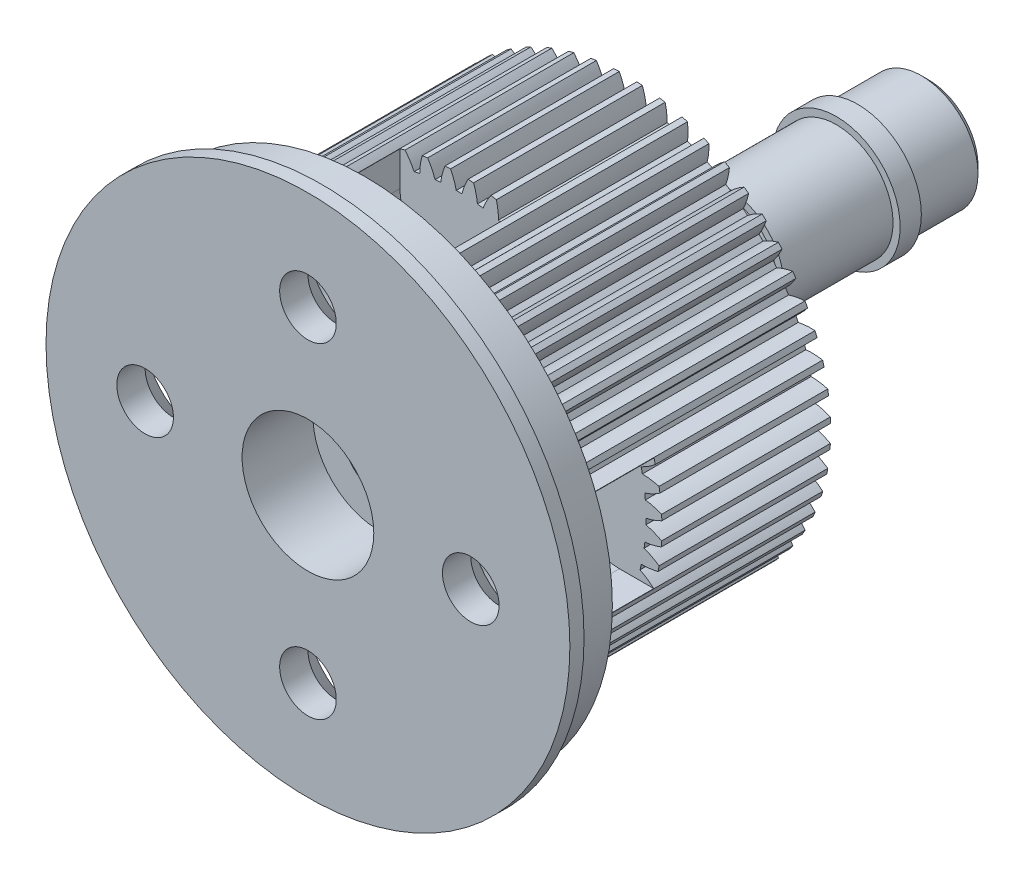
from build123d import *

# Parameters (mm, degrees)
SKETCH1_R           = 14.5
BOSS_EXTRUDE1_DEPTH = 16.661690565
CUT_EXTRUDE1_DEPTH  = 27.421807896
CIRPATTERN2_COUNT   = 56
SKETCH3_W           = 17.5
SKETCH3_H           = 4
CHAMFER2_SIZE       = 0.5
SKETCH4_R           = 2.5
CUT_EXTRUDE2_DEPTH  = 51.328806271
SKETCH5_R           = 4.65
CUT_EXTRUDE3_DEPTH  = 5
SKETCH6_R           = 2
CUT_EXTRUDE4_DEPTH  = 47.887116478
CIRPATTERN3_COUNT   = 4
CUT_EXTRUDE9_DEPTH  = 6.5
SKETCH9_R           = 18.5
SKETCH9_R_2         = 17.5
BOSS_EXTRUDE2_DEPTH = 1
CIRPATTERN4_COUNT   = 4
CUT_EXTRUDE12_START = -14.90536252
SKETCH10_R          = 20.678768913
SKETCH10_R_2        = 4
CUT_EXTRUDE12_DEPTH = 14.90536252
SKETCH11_R          = 4.5
SKETCH11_R_2        = 4
BOSS_EXTRUDE3_DEPTH = 1.5
CUT_EXTRUDE13_START = 5
SKETCH12_R          = 4
SKETCH12_R_2        = 3.5
CUT_EXTRUDE13_DEPTH = 0.7


with BuildPart() as part:
    # Sketch1 → Boss-Extrude1 (new, symmetric)
    with BuildSketch(Plane.XY):
        Circle(SKETCH1_R)
    extrude(amount=BOSS_EXTRUDE1_DEPTH, both=True)

    # Sketch2 → Cut-Extrude1 (cut, symmetric)
    with BuildSketch(Plane.XY):
        with BuildLine():
            ThreePointArc((13.374972872, 0.026938295), (13.374993218, 0.013469154), (13.375, 0))
            ThreePointArc((13.375, 0), (13.37384438, -0.175816675), (13.370377719, -0.351602969))
            ThreePointArc((13.370377719, -0.351602969), (13.370016861, -0.36506729), (13.369642445, -0.378531241))
            add(Edge.make_bspline(
                [(13.369642445, -0.378531241), (13.390928425, -0.383060658), (13.434491441, -0.392881127), (13.500038107, -0.409193304), (13.587134794, -0.433619895), (13.674599675, -0.460663373), (13.761421833, -0.489861282), (13.847500801, -0.520944712), (13.951247766, -0.560946326), (14.074899689, -0.612172445), (14.218235723, -0.676764692), (14.342643779, -0.737625304), (14.42842691, -0.782072845), (14.473174045, -0.805878272), (14.477460763, -0.808164492)],
                knots=[0.066092985, 0.066092985, 0.066092985, 0.066092985, 0.066092985, 0.092110525, 0.119476176, 0.146842496, 0.174208854, 0.201574956, 0.228941013, 0.256307345, 0.307035032, 0.361767352, 0.416499661, 0.422302771, 0.422302771, 0.422302771, 0.422302771, 0.422302771], degree=4))
            ThreePointArc((14.477460763, -0.808164492), (14.494364096, -0.404239367), (14.5, 0))
            ThreePointArc((14.5, 0), (14.498425557, 0.213673531), (14.493702569, 0.427300661))
            add(Edge.make_bspline(
                [(13.374972872, 0.026938295), (13.396370566, 0.030906579), (13.440176688, 0.039578467), (13.506129518, 0.054161911), (13.593838233, 0.076290457), (13.681983808, 0.101025306), (13.769543517, 0.127930736), (13.85640986, 0.156740574), (13.961172537, 0.194001056), (14.086128362, 0.241958902), (14.231112867, 0.302760797), (14.357077837, 0.360329929), (14.443999762, 0.402507037), (14.489357231, 0.425127921), (14.493702569, 0.427300661)],
                knots=[0.066092985, 0.066092985, 0.066092985, 0.066092985, 0.066092985, 0.092110525, 0.119476176, 0.146842496, 0.174208854, 0.201574956, 0.228941013, 0.256307345, 0.307035032, 0.361767352, 0.416499661, 0.422302771, 0.422302771, 0.422302771, 0.422302771, 0.422302771], degree=4))
        make_face()
    cut_extrude1 = extrude(amount=CUT_EXTRUDE1_DEPTH, both=True, mode=Mode.SUBTRACT)

    # CirPattern2: Cut-Extrude1 ×56 about axis
    cirpattern2_axis = Axis((0, 0, -16.661690565), (0, 0, 1))
    for i in range(1, CIRPATTERN2_COUNT):
        add(cut_extrude1.rotate(cirpattern2_axis, i * 360 / CIRPATTERN2_COUNT), mode=Mode.SUBTRACT)

    # Sketch3 → Revolve1 (revolve)
    with BuildSketch(Plane(origin=(0, 0, 0), x_dir=(1, 0, 0), z_dir=(0, 1, 0))):
        Polygon((0, 16.661690565), (0, 23.161690565), (-4, 23.161690565), (-4, 18.161690565), (-4.5, 18.161690565), (-4.5, 16.661690565), align=None)
        with Locations((-8.75, -18.661690565)):
            Rectangle(SKETCH3_W, SKETCH3_H)
    revolve(axis=Axis((0, 0, -16.661690565), (0, 0, -1)))

    # Chamfer2
    chamfer2_edges = [part.edges().sort_by_distance(p)[0] for p in [
        (4, 0, -23.161690565),
    ]]
    chamfer(chamfer2_edges, length=CHAMFER2_SIZE)

    # Sketch4 → Cut-Extrude2 (cut, through all)
    with BuildSketch(Plane.XY.offset(20.661690565)):
        Circle(SKETCH4_R)
    extrude(amount=-CUT_EXTRUDE2_DEPTH, mode=Mode.SUBTRACT)

    # Sketch5 → Cut-Extrude3 (cut)
    with BuildSketch(Plane.XY.offset(20.661690565)):
        Circle(SKETCH5_R)
    extrude(amount=-CUT_EXTRUDE3_DEPTH, mode=Mode.SUBTRACT)

    # Sketch6 → Cut-Extrude4 (cut, through all)
    with BuildSketch(Plane(origin=(0, 0, 16.661690565), x_dir=(-1, 0, 0), z_dir=(0, 0, -1))):
        with Locations((0, 11.5)):
            Circle(SKETCH6_R)
        with Locations((11.5, 0)):
            Circle(SKETCH6_R)
        with Locations((0, -11.5)):
            Circle(SKETCH6_R)
        with Locations((-11.5, 0)):
            Circle(SKETCH6_R)
    extrude(amount=-CUT_EXTRUDE4_DEPTH, mode=Mode.SUBTRACT)

    # Sketch7 → Cut-Revolve1 (revolve, cut)
    with BuildSketch(Plane(origin=(0, 0, 0), x_dir=(1, 0, 0), z_dir=(0, 1, 0))):
        Polygon((15.5, -16.661690565), (11.5, -16.661690565), (11.5, -18.661690565), (13.5, -18.661690565), align=None)
    cut_revolve1 = revolve(axis=Axis((11.5, 0, 16.661690565), (0, 0, 1)), mode=Mode.SUBTRACT)

    # CirPattern3: Cut-Revolve1 ×4 about axis
    cirpattern3_axis = Axis((0, 0, -23.161690565), (0, 0, 1))
    for i in range(1, CIRPATTERN3_COUNT):
        add(cut_revolve1.rotate(cirpattern3_axis, i * 360 / CIRPATTERN3_COUNT), mode=Mode.SUBTRACT)

    # Sketch8 → Cut-Extrude9 (cut)
    with BuildSketch(Plane(origin=(0, 0, 16.661690565), x_dir=(-1, 0, 0), z_dir=(0, 0, -1))):
        with BuildLine():
            Line((-4, 14.974979132), (-4, 11.5))
            ThreePointArc((-4, 11.5), (0, 7.5), (4, 11.5))
            Line((4, 11.5), (4, 14.974979132))
            ThreePointArc((4, 14.974979132), (0, 15.5), (-4, 14.974979132))
        make_face()
    cut_extrude9 = extrude(amount=CUT_EXTRUDE9_DEPTH, mode=Mode.SUBTRACT)

    # Sketch9 → Boss-Extrude2 (add)
    with BuildSketch(Plane.XY.offset(20.661690565)):
        Circle(SKETCH9_R)
        Circle(SKETCH9_R_2, mode=Mode.SUBTRACT)
    extrude(amount=-BOSS_EXTRUDE2_DEPTH)

    # CirPattern4: Cut-Extrude9 ×4 about axis
    cirpattern4_axis = Axis((0, 0, -16.661690565), (0, 0, 1))
    for i in range(1, CIRPATTERN4_COUNT):
        add(cut_extrude9.rotate(cirpattern4_axis, i * 360 / CIRPATTERN4_COUNT), mode=Mode.SUBTRACT)

    # Sketch10 → Cut-Extrude12 (cut)
    with BuildSketch(Plane(origin=(0, 0, -16.661690565), x_dir=(-1, 0, 0), z_dir=(0, 0, -1)).offset(CUT_EXTRUDE12_START)):
        Circle(SKETCH10_R)
        Circle(SKETCH10_R_2, mode=Mode.SUBTRACT)
    extrude(amount=CUT_EXTRUDE12_DEPTH, mode=Mode.SUBTRACT)

    # Sketch11 → Boss-Extrude3 (add)
    with BuildSketch(Plane(origin=(0, 0, -1.756328045), x_dir=(-1, 0, 0), z_dir=(0, 0, -1))):
        Circle(SKETCH11_R)
        Circle(SKETCH11_R_2, mode=Mode.SUBTRACT)
    extrude(amount=BOSS_EXTRUDE3_DEPTH)

    # Sketch12 → Cut-Extrude13 (cut)
    with BuildSketch(Plane(origin=(0, 0, -3.256328045), x_dir=(-1, 0, 0), z_dir=(0, 0, -1)).offset(CUT_EXTRUDE13_START)):
        Circle(SKETCH12_R)
        Circle(SKETCH12_R_2, mode=Mode.SUBTRACT)
    extrude(amount=CUT_EXTRUDE13_DEPTH, mode=Mode.SUBTRACT)


solid = part.part
